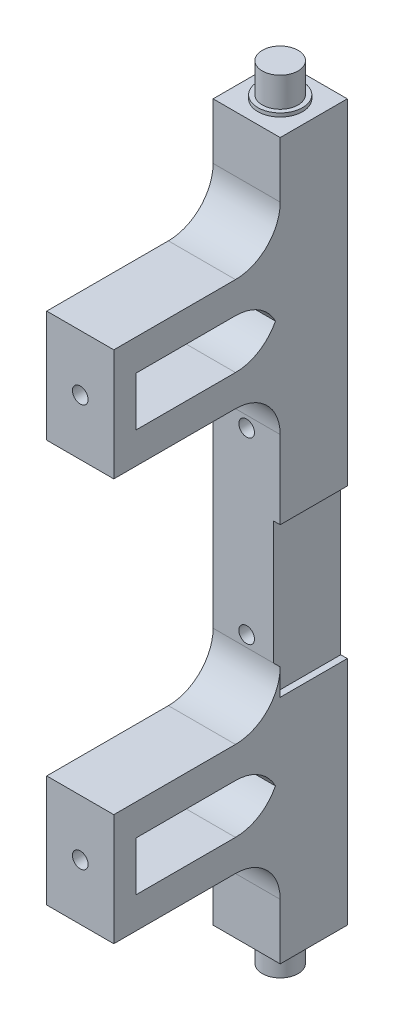
from build123d import *

# Parameters (mm, degrees)
ESQUISSE1_W                      = 25
ESQUISSE1_H                      = 15
BOSS_EXTRU_1_DEPTH               = 37.2
BOSS_EXTRU_1_2_DEPTH             = 37.2
ESQUISSE3_W                      = 160
ESQUISSE3_H                      = 15
BOSS_EXTRU_2_DEPTH               = 15
ESQUISSE4_R                      = 5
ESQUISSE4_R_2                    = 4
BOSS_EXTRU_5_DEPTH               = 0.8
ESQUISSE4_6_R                    = 4
BOSS_EXTRU_6_DEPTH               = 7.4
CONG_1_R                         = 10
ESQUISSE5_W                      = 11
ESQUISSE5_H                      = 32.2
ENL_V_MAT_EXTRU_1_DEPTH          = 97.164442493
CONG_2_R                         = 10
ESQUISSE6_R                      = 1.75
ENL_V_MAT_EXTRU_2_DEPTH          = 100.613503101
ESQUISSE11_R                     = 1.75
TROUS_VIS_SUPPORT_CAPTEURS_DEPTH = 96.282999533
ESQUISSE12_W                     = 33.4
ESQUISSE12_H                     = 4.7
ENCOCHE_CARTE_CAPTEUR_DEPTH      = 96.282999533


with BuildPart() as part:
    # Esquisse1 → Boss.-Extru.1 (new body)
    with BuildSketch(Plane(origin=(0, 0, 0), x_dir=(0, 1, 0), z_dir=(0, 0, 1))):
        with Locations((-45, 0)):
            Rectangle(ESQUISSE1_W, ESQUISSE1_H)
    extrude(amount=BOSS_EXTRU_1_DEPTH)



with BuildPart() as body_2:
    # Esquisse1 → Boss.-Extru.1 2 (new body)
    with BuildSketch(Plane(origin=(0, 0, 0), x_dir=(0, 1, 0), z_dir=(0, 0, 1))):
        with Locations((45, 0)):
            Rectangle(ESQUISSE1_W, ESQUISSE1_H)
    extrude(amount=BOSS_EXTRU_1_2_DEPTH)


with BuildPart() as part_1:
    add(part.part)

    add(body_2.part)  # Boss.-Extru.2 merges body 2
    # Esquisse3 → Boss.-Extru.2 (add)
    with BuildSketch(Plane(origin=(0, 0, 0), x_dir=(0, 1, 0), z_dir=(0, 0, 1))):
        Rectangle(ESQUISSE3_W, ESQUISSE3_H)
    extrude(amount=-BOSS_EXTRU_2_DEPTH)

    # Esquisse4 → Boss.-Extru.5 (add)
    with BuildSketch(Plane(origin=(0, -80, 0), x_dir=(-1, 0, 0), z_dir=(0, -1, 0))):
        with Locations(Location((0, 7.5, 0), (0, 0, 90))):
            Circle(ESQUISSE4_R)
        with Locations(Location((0, 7.5, 0), (0, 0, 90))):
            Circle(ESQUISSE4_R_2, mode=Mode.SUBTRACT)
    boss_extru_5 = extrude(amount=BOSS_EXTRU_5_DEPTH)

    # Esquisse4<6> → Boss.-Extru.6 (add)
    with BuildSketch(Plane(origin=(0, -80, 0), x_dir=(-1, 0, 0), z_dir=(0, -1, 0))):
        with Locations(Location((0, 7.5, 0), (0, 0, 90))):
            Circle(ESQUISSE4_6_R)
    boss_extru_6 = extrude(amount=BOSS_EXTRU_6_DEPTH)

    # Symétrie2: Boss.-Extru.5, Boss.-Extru.6 across plane
    add(boss_extru_5.mirror(Plane.ZX))
    add(boss_extru_6.mirror(Plane.ZX))

    # Congé1
    cong_1_edges = [part_1.edges().sort_by_distance(p)[0] for p in [
        (0, 57.5, 0),
        (0, 32.5, 0),
        (0, -57.5, 0),
        (0, -32.5, 0),
    ]]
    fillet(cong_1_edges, radius=CONG_1_R)

    # Esquisse5 → Enlèv. mat.-Extru.1 (cut, through all)
    with BuildSketch(Plane(origin=(-7.5, 0, 0), x_dir=(0, -1, 0), z_dir=(-1, 0, 0))):
        with Locations((45, 16.1)):
            Rectangle(ESQUISSE5_W, ESQUISSE5_H)
        with Locations((-45, 16.1)):
            Rectangle(ESQUISSE5_W, ESQUISSE5_H)
    extrude(amount=-ENL_V_MAT_EXTRU_1_DEPTH, mode=Mode.SUBTRACT)

    # Congé2
    # the kernel refuses this fillet: 10 mm, written as the material it adds along each edge
    with BuildSketch(Plane(origin=(-7.5, 39.5, 0), x_dir=(0, 0, 1), z_dir=(1, 0, 0)), Plane(origin=(-7.5, -39.5, 0), x_dir=(0, -1, 0), z_dir=(1, 0, 0)), Plane(origin=(-7.5, -50.5, 0), x_dir=(0, 0, 1), z_dir=(1, 0, 0))) as cong_2_piece_1:
        with BuildLine():
            CenterArc((CONG_2_R, -CONG_2_R), CONG_2_R, 90, 90)
            Line((0, -CONG_2_R), (0, 0))
            Line((0, 0), (CONG_2_R, 0))
        make_face()
    extrude(amount=15)
    with BuildSketch(Plane(origin=(-7.5, 50.5, 0), x_dir=(0, 0, 1), z_dir=(1, 0, 0))) as cong_2_piece_2:
        with BuildLine():
            CenterArc((CONG_2_R, CONG_2_R), CONG_2_R, 180, 90)
            Line((0, CONG_2_R), (0, 0))
            Line((0, 0), (CONG_2_R, 0))
        make_face()
    extrude(amount=15)

    # Esquisse6 → Enlèv. mat.-Extru.2 (cut, through all)
    with BuildSketch(Plane(origin=(0, 0, 32.2), x_dir=(1, 0, 0), z_dir=(0, 0, -1))):
        with Locations(Location((0, 45, 0), (0, 0, 180))):
            Circle(ESQUISSE6_R)
        with Locations((0, -45)):
            Circle(ESQUISSE6_R)
    extrude(amount=-ENL_V_MAT_EXTRU_2_DEPTH, mode=Mode.SUBTRACT)

    # Esquisse11 → Trous vis support capteurs (cut, through all)
    with BuildSketch(Plane(origin=(0, 0, 0), x_dir=(0, 1, 0), z_dir=(0, 0, 1))):
        with Locations(Location((20, 0, 0), (0, 0, 270))):
            Circle(ESQUISSE11_R)
        with Locations(Location((-20, 0, 0), (0, 0, 270))):
            Circle(ESQUISSE11_R)
    extrude(amount=-TROUS_VIS_SUPPORT_CAPTEURS_DEPTH, mode=Mode.SUBTRACT)

    # Esquisse12 → Encoche carte capteur (cut, through all)
    with BuildSketch(Plane(origin=(0, 0, 0), x_dir=(0, 1, 0), z_dir=(0, 0, 1))):
        with Locations((-11.675958981, -8.388484641)):
            Rectangle(ESQUISSE12_W, ESQUISSE12_H)
    extrude(amount=-ENCOCHE_CARTE_CAPTEUR_DEPTH, mode=Mode.SUBTRACT)


solid = part_1.part
